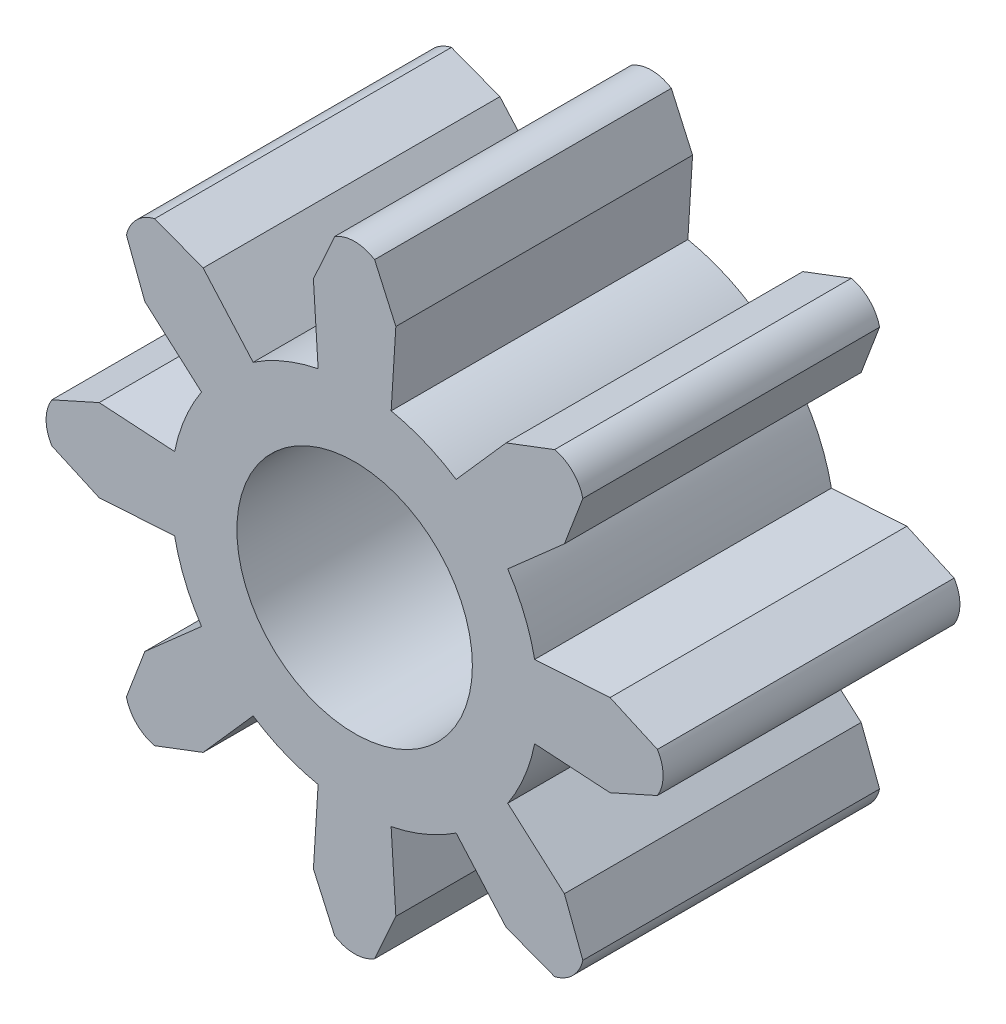
from build123d import *

# Parameters (mm, degrees)
SZKIC1_R                    = 2.5
DODANIE_WYCI_GNI_CIE1_DEPTH = 6.3


with BuildPart() as part:
    # Szkic1 → Dodanie-wyciągnięcie1 (new body)
    with BuildSketch(Plane.XY):
        with BuildLine():
            Line((0.775, 3.822221213), (0.875, 5.423398291))
            Line((0.875, 5.423398291), (0.424123551, 6.427723795))
            ThreePointArc((0.424123551, 6.427723795), (0.220699035, 6.518820836), (0, 6.55))
            ThreePointArc((0, 6.55), (-0.220699035, 6.518820836), (-0.424123551, 6.427723795))
            Line((-0.424123551, 6.427723795), (-0.875, 5.423398291))
            Line((-0.875, 5.423398291), (-0.775, 3.822221213))
            ThreePointArc((-0.775, 3.822221213), (-1.492465386, 3.603130177), (-2.154710783, 3.250726294))
            Line((-2.154710783, 3.250726294), (-3.216203275, 4.453640142))
            Line((-3.216203275, 4.453640142), (-4.245186445, 4.844987722))
            ThreePointArc((-4.245186445, 4.844987722), (-4.453444634, 4.765560203), (-4.631549417, 4.631549417))
            ThreePointArc((-4.631549417, 4.631549417), (-4.765560203, 4.453444634), (-4.844987722, 4.245186445))
            Line((-4.844987722, 4.245186445), (-4.453640142, 3.216203275))
            Line((-4.453640142, 3.216203275), (-3.250726294, 2.154710783))
            ThreePointArc((-3.250726294, 2.154710783), (-3.603130177, 1.492465386), (-3.822221213, 0.775))
            Line((-3.822221213, 0.775), (-5.423398291, 0.875))
            Line((-5.423398291, 0.875), (-6.427723795, 0.424123551))
            ThreePointArc((-6.427723795, 0.424123551), (-6.518820836, 0.220699035), (-6.55, 0))
            ThreePointArc((-6.55, 0), (-6.518820836, -0.220699035), (-6.427723795, -0.424123551))
            Line((-6.427723795, -0.424123551), (-5.423398291, -0.875))
            Line((-5.423398291, -0.875), (-3.822221213, -0.775))
            ThreePointArc((-3.822221213, -0.775), (-3.603130177, -1.492465386), (-3.250726294, -2.154710783))
            Line((-3.250726294, -2.154710783), (-4.453640142, -3.216203275))
            Line((-4.453640142, -3.216203275), (-4.844987722, -4.245186445))
            ThreePointArc((-4.844987722, -4.245186445), (-4.765560203, -4.453444634), (-4.631549417, -4.631549417))
            ThreePointArc((-4.631549417, -4.631549417), (-4.453444634, -4.765560203), (-4.245186445, -4.844987722))
            Line((-4.245186445, -4.844987722), (-3.216203275, -4.453640142))
            Line((-3.216203275, -4.453640142), (-2.154710783, -3.250726294))
            ThreePointArc((-2.154710783, -3.250726294), (-1.492465386, -3.603130177), (-0.775, -3.822221213))
            Line((-0.775, -3.822221213), (-0.875, -5.423398291))
            Line((-0.875, -5.423398291), (-0.424123551, -6.427723795))
            ThreePointArc((-0.424123551, -6.427723795), (-0.220699035, -6.518820836), (0, -6.55))
            ThreePointArc((0, -6.55), (0.220699035, -6.518820836), (0.424123551, -6.427723795))
            Line((0.424123551, -6.427723795), (0.875, -5.423398291))
            Line((0.875, -5.423398291), (0.775, -3.822221213))
            ThreePointArc((0.775, -3.822221213), (1.492465386, -3.603130177), (2.154710783, -3.250726294))
            Line((2.154710783, -3.250726294), (3.216203275, -4.453640142))
            Line((3.216203275, -4.453640142), (4.245186445, -4.844987722))
            ThreePointArc((4.245186445, -4.844987722), (4.453444634, -4.765560203), (4.631549417, -4.631549417))
            ThreePointArc((4.631549417, -4.631549417), (4.765560203, -4.453444634), (4.844987722, -4.245186445))
            Line((4.844987722, -4.245186445), (4.453640142, -3.216203275))
            Line((4.453640142, -3.216203275), (3.250726294, -2.154710783))
            ThreePointArc((3.250726294, -2.154710783), (3.603130177, -1.492465386), (3.822221213, -0.775))
            Line((3.822221213, -0.775), (5.423398291, -0.875))
            Line((5.423398291, -0.875), (6.427723795, -0.424123551))
            ThreePointArc((6.427723795, -0.424123551), (6.518820836, -0.220699035), (6.55, 0))
            ThreePointArc((6.55, 0), (6.518820836, 0.220699035), (6.427723795, 0.424123551))
            Line((6.427723795, 0.424123551), (5.423398291, 0.875))
            Line((5.423398291, 0.875), (3.822221213, 0.775))
            ThreePointArc((3.822221213, 0.775), (3.603130177, 1.492465386), (3.250726294, 2.154710783))
            Line((3.250726294, 2.154710783), (4.453640142, 3.216203275))
            Line((4.453640142, 3.216203275), (4.844987722, 4.245186445))
            ThreePointArc((4.844987722, 4.245186445), (4.765560203, 4.453444634), (4.631549417, 4.631549417))
            ThreePointArc((4.631549417, 4.631549417), (4.453444634, 4.765560203), (4.245186445, 4.844987722))
            Line((4.245186445, 4.844987722), (3.216203275, 4.453640142))
            Line((3.216203275, 4.453640142), (2.154710783, 3.250726294))
            ThreePointArc((2.154710783, 3.250726294), (1.492465386, 3.603130177), (0.775, 3.822221213))
        make_face()
        Circle(SZKIC1_R, mode=Mode.SUBTRACT)
    extrude(amount=DODANIE_WYCI_GNI_CIE1_DEPTH)


solid = part.part
